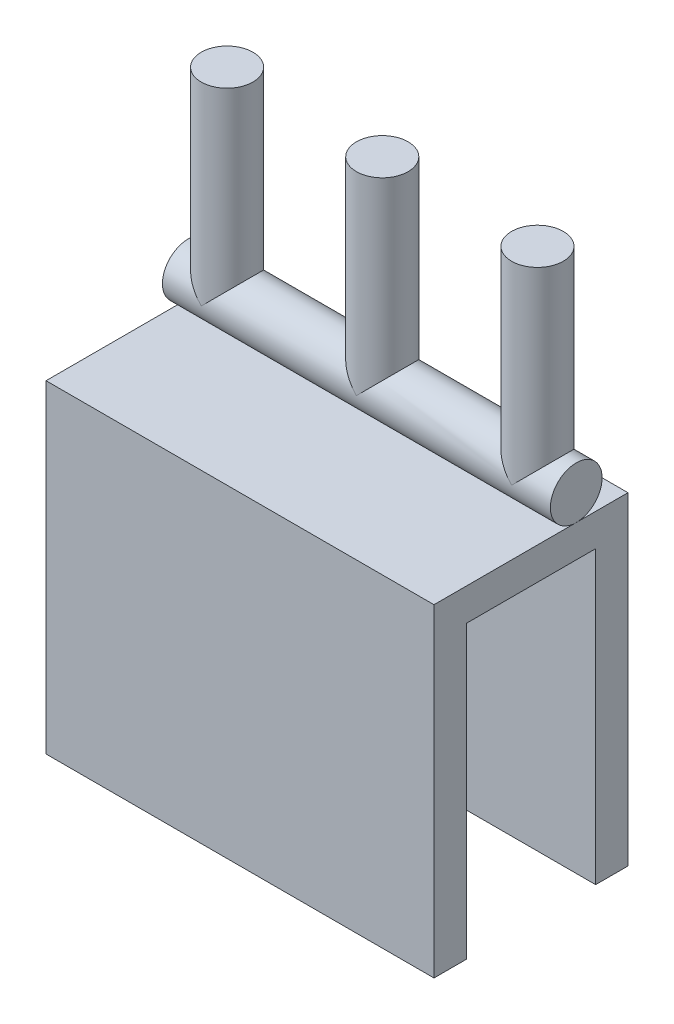
from build123d import *

# Parameters (mm, degrees)
EXTRUDE_1_DEPTH = 300
SKETCH_2_R      = 20
EXTRUDE_2_DEPTH = 300
SKETCH_3_R      = 20
EXTRUDE_3_DEPTH = 150


with BuildPart() as part:
    # 스케치1 → 보스-돌출1 (new body)
    with BuildSketch(Plane(origin=(0, 0, 0), x_dir=(0, 0, -1), z_dir=(1, 0, 0))):
        Polygon((-50, -125), (-75, -125), (-75, 125), (75, 125), (75, -125), (50, -125), (50, 100), (-50, 100), align=None)
    extrude(amount=EXTRUDE_1_DEPTH)


with BuildPart() as body_2:
    # 스케치2 → 보스-돌출2 (new body)
    with BuildSketch(Plane(origin=(0, 0, 0), x_dir=(0, 0, -1), z_dir=(1, 0, 0))):
        with Locations((35, 145)):
            Circle(SKETCH_2_R)
    extrude(amount=EXTRUDE_2_DEPTH)

    # 스케치3 → 보스-돌출3 (add)
    with BuildSketch(Plane(origin=(0, 145, 0), x_dir=(1, 0, 0), z_dir=(0, 1, 0))):
        with Locations((30, 35)):
            Circle(SKETCH_3_R)
        with Locations((150, 35)):
            Circle(SKETCH_3_R)
        with Locations((270, 35)):
            Circle(SKETCH_3_R)
    extrude(amount=EXTRUDE_3_DEPTH)


solid = Compound([part.part, body_2.part])
